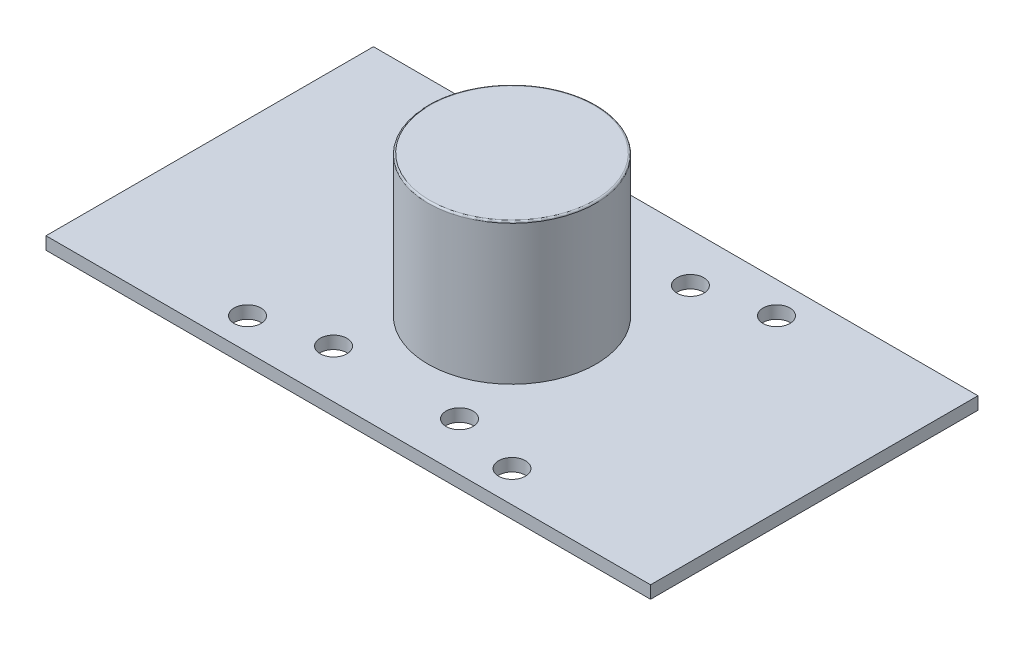
from build123d import *

# Parameters (mm, degrees)
SKETCH1_W           = 72
SKETCH1_H           = 39
BOSS_EXTRUDE1_DEPTH = 1.5
SKETCH2_R           = 10
BOSS_EXTRUDE2_DEPTH = 16.8
SKETCH3_R           = 1.6
CUT_EXTRUDE1_DEPTH  = 16.8
SKETCH4_R           = 1.6
CUT_EXTRUDE2_DEPTH  = 16.8
FILLET1_R           = 0.2


with BuildPart() as part:
    # Sketch1 → Boss-Extrude1 (new body)
    with BuildSketch(Plane(origin=(0, 0, 0), x_dir=(1, 0, 0), z_dir=(0, 1, 0))):
        with Locations((36, 19.5)):
            Rectangle(SKETCH1_W, SKETCH1_H)
    extrude(amount=BOSS_EXTRUDE1_DEPTH)

    # Sketch2 → Boss-Extrude2 (add)
    with BuildSketch(Plane(origin=(0, 1.5, 0), x_dir=(1, 0, 0), z_dir=(0, 1, 0))):
        with Locations((36, 19.5)):
            Circle(SKETCH2_R)
    extrude(amount=BOSS_EXTRUDE2_DEPTH)

    # Sketch3 → Cut-Extrude1 (cut)
    with BuildSketch(Plane(origin=(0, 1.5, 0), x_dir=(1, 0, 0), z_dir=(0, 1, 0))):
        with Locations((43.5, 5.75)):
            Circle(SKETCH3_R)
        with Locations((28.5, 5.75)):
            Circle(SKETCH3_R)
        with Locations((28.5, 33.25)):
            Circle(SKETCH3_R)
        with Locations((43.5, 33.25)):
            Circle(SKETCH3_R)
    extrude(amount=-CUT_EXTRUDE1_DEPTH, mode=Mode.SUBTRACT)

    # Sketch4 → Cut-Extrude2 (cut)
    with BuildSketch(Plane(origin=(0, 1.5, 0), x_dir=(1, 0, 0), z_dir=(0, 1, 0))):
        with Locations((51.75, 3.75)):
            Circle(SKETCH4_R)
        with Locations((51.75, 35.25)):
            Circle(SKETCH4_R)
        with Locations((20.25, 3.75)):
            Circle(SKETCH4_R)
        with Locations((20.25, 35.25)):
            Circle(SKETCH4_R)
    extrude(amount=-CUT_EXTRUDE2_DEPTH, mode=Mode.SUBTRACT)

    # Fillet1
    fillet1_edges = [part.edges().sort_by_distance(p)[0] for p in [
        (26, 18.3, -19.5),
    ]]
    fillet(fillet1_edges, radius=FILLET1_R)


solid = part.part
